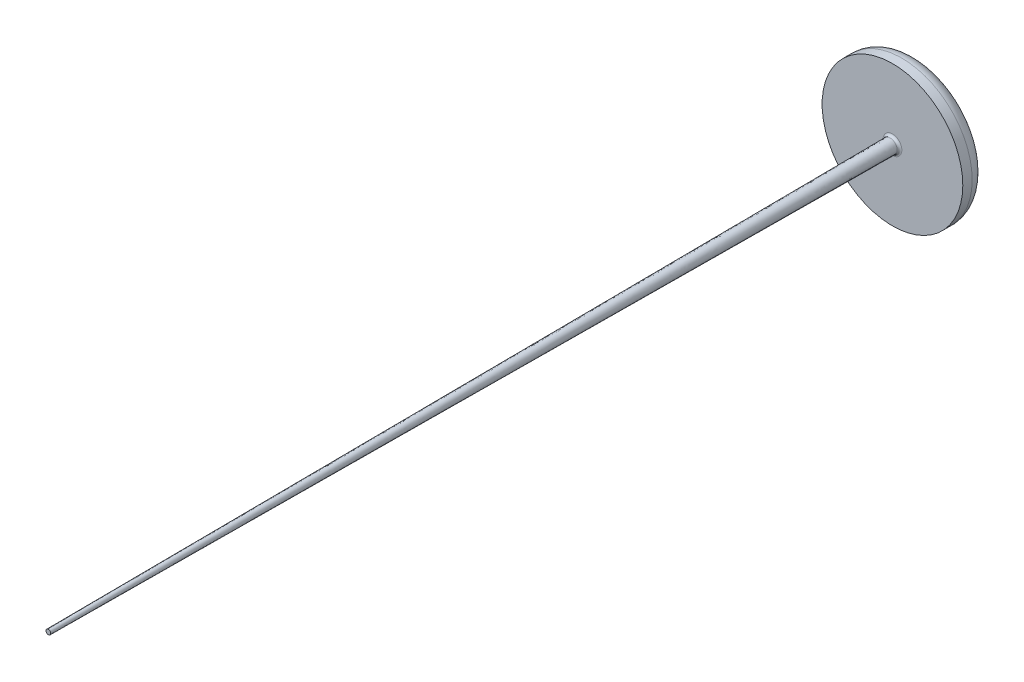
from build123d import *

# Parameters (mm, degrees)
SKETCH8_R           = 15
BOSS_EXTRUDE1_DEPTH = 5
FILLET1_R           = 3
FILLET2_R           = 0.5


with BuildPart() as part:
    # Loft1: read off the stored shape, not the designer's step
    # Loft1: loft between two sections, ruled curve by curve
    loft1_from = [
        Edge.make_bspline([(0.305459622, -0.395846459, 211), (-0.486233297, -1.006765703, 211), (-1.097152541, -0.215072785, 211), (-0.305459622, 0.395846459, 211), (0.486233297, 1.006765703, 211), (1.097152541, 0.215072785, 211), (0.305459622, -0.395846459, 211)], [0, 0, 0, 0, 0.5, 0.5, 0.5, 1, 1, 1, 1], 3, [1, 0.333333333, 0.333333333, 1, 0.333333333, 0.333333333, 1]),
    ]
    loft1_to = [
        Edge.make_bspline([(1.302480056, -0.744006522, 31), (-0.185532988, -3.348966633, 31), (-2.790493099, -1.86095359, 31), (-1.302480056, 0.744006522, 31), (0.185532988, 3.348966633, 31), (2.790493099, 1.86095359, 31), (1.302480056, -0.744006522, 31)], [0, 0, 0, 0, 0.5, 0.5, 0.5, 1, 1, 1, 1], 3, [1, 0.333333333, 0.333333333, 1, 0.333333333, 0.333333333, 1]),
    ]
    loft1 = Solid(Shell([*[Face.make_surface_from_curves(loft1_from[k], loft1_to[k]) for k in range(1)], Face(Wire(loft1_from)), Face(Wire(loft1_to))]))
    add(loft1)

    # Sketch8 → Boss-Extrude1 (add)
    with BuildSketch(Plane.XY.offset(31)):
        Circle(SKETCH8_R)
    extrude(amount=-BOSS_EXTRUDE1_DEPTH)

    # Fillet1
    fillet1_edges = [part.edges().sort_by_distance(p)[0] for p in [
        (-15, 0, 26),
    ]]
    fillet(fillet1_edges, radius=FILLET1_R)

    # Fillet2
    fillet2_edges = [part.edges().sort_by_distance(p)[0] for p in [
        (-1.302480056, 0.744006522, 31),
    ]]
    fillet(fillet2_edges, radius=FILLET2_R)


solid = part.part
